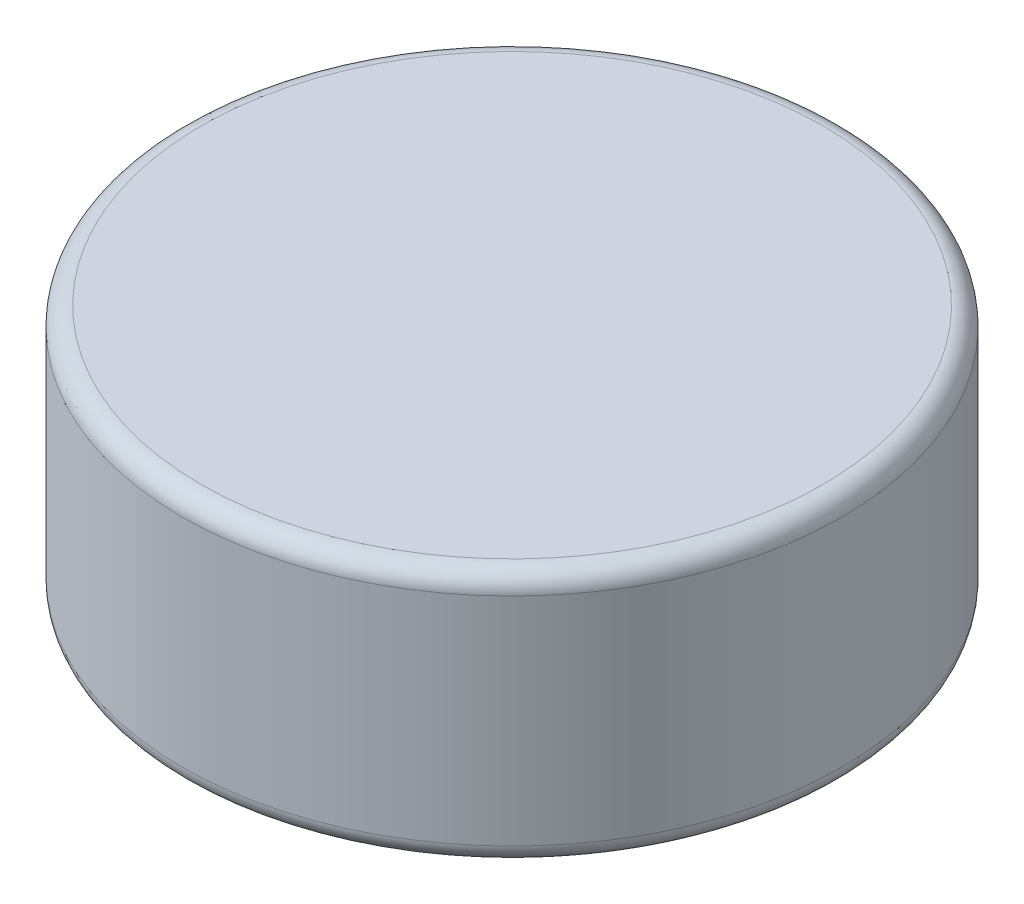
from build123d import *

# Parameters (mm, degrees)
ESBO_O1_R                = 35
RESSALTO_EXTRUS_O1_DEPTH = 27
FILETE1_R                = 2
ESBO_O2_R                = 5.75
RESSALTO_EXTRUS_O2_DEPTH = 2
ESBO_O3_R                = 3
CORTE_EXTRUS_O1_DEPTH    = 5


with BuildPart() as part:
    # Esboço1 → Ressalto-extrusão1 (new body)
    with BuildSketch(Plane(origin=(0, 0, 0), x_dir=(1, 0, 0), z_dir=(0, 1, 0))):
        Circle(ESBO_O1_R)
    extrude(amount=RESSALTO_EXTRUS_O1_DEPTH)

    # Filete1
    filete1_edges = [part.edges().sort_by_distance(p)[0] for p in [
        (-35, 0, 0),
        (-35, 27, 0),
    ]]
    fillet(filete1_edges, radius=FILETE1_R)

    # Esboço2 → Ressalto-extrusão2 (add)
    with BuildSketch(Plane(origin=(0, 0, 0), x_dir=(-1, 0, 0), z_dir=(0, -1, 0))):
        Circle(ESBO_O2_R)
    extrude(amount=RESSALTO_EXTRUS_O2_DEPTH)

    # Esboço3 → Corte-extrusão1 (cut)
    with BuildSketch(Plane.XZ.offset(2)):
        Circle(ESBO_O3_R)
    extrude(amount=-CORTE_EXTRUS_O1_DEPTH, mode=Mode.SUBTRACT)


solid = part.part
